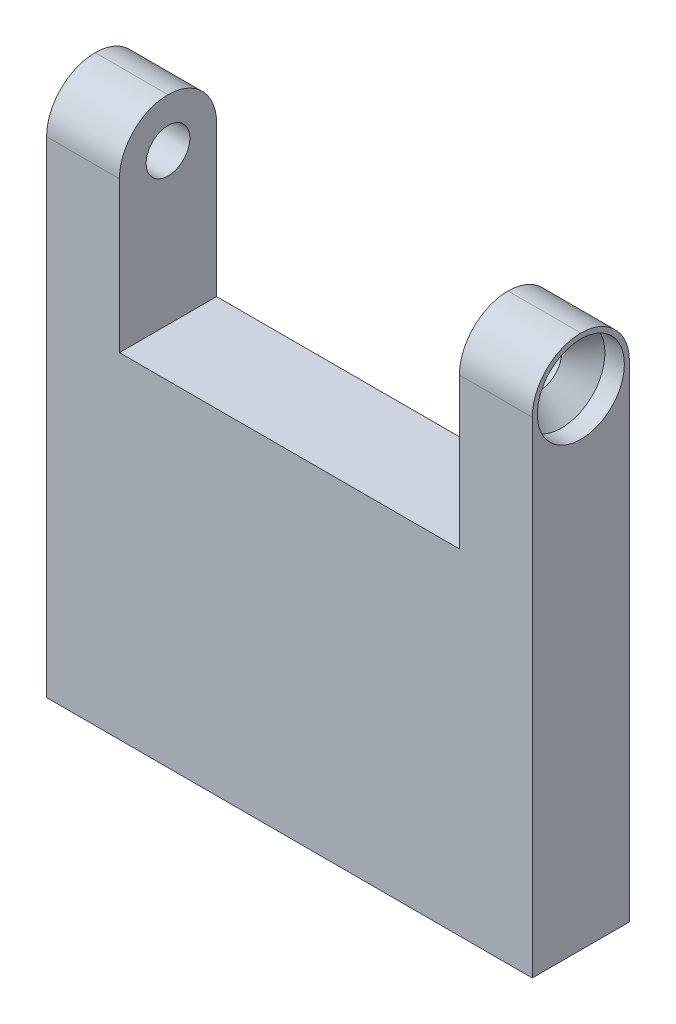
from build123d import *

# Parameters (mm, degrees)
SKETCH1_W                = 50
SKETCH1_H                = 10
BOSS_EXTRUDE1_DEPTH      = 55
FILLET1_R                = 5
SKETCH2_W                = 35
SKETCH2_H                = 20.5
CUT_EXTRUDE1_DEPTH       = 62.23724357
M4_CLEARANCE_HOLE1_D     = 4.5
M4_CLEARANCE_HOLE1_DEPTH = 9
M4_CLEARANCE_HOLE1_TIP   = 1.351936393
SKETCH9_W                = 7.4
SKETCH9_H                = 4
CUT_EXTRUDE2_DEPTH       = 9


with BuildPart() as part:
    # Sketch1 → Boss-Extrude1 (new body)
    with BuildSketch(Plane(origin=(0, 0, 0), x_dir=(1, 0, 0), z_dir=(0, 1, 0))):
        Rectangle(SKETCH1_W, SKETCH1_H)
    extrude(amount=BOSS_EXTRUDE1_DEPTH)

    # Fillet1
    fillet1_edges = [part.edges().sort_by_distance(p)[0] for p in [
        (0, 55, -5),
        (0, 55, 5),
    ]]
    fillet(fillet1_edges, radius=FILLET1_R - 0.0001)  # a hair under: the kernel refuses the full size

    # Sketch2 → Cut-Extrude1 (cut, through all)
    with BuildSketch(Plane.XY.offset(5)):
        with Locations((0, 44.75)):
            Rectangle(SKETCH2_W, SKETCH2_H)
    extrude(amount=-CUT_EXTRUDE1_DEPTH, mode=Mode.SUBTRACT)

    # Sketch5 → CSK for M4 SFHCS1 (revolve, cut)
    with BuildSketch(Plane(origin=(-25, 50, 0), x_dir=(0, 0, 1), z_dir=(0, 1, 0))):
        Polygon((0, 0), (0, 50), (2.25, 50), (2.25, 4.23), (4.48, 2), (4.48, 0), align=None)
    csk_for_m4_sfhcs1 = revolve(axis=Axis((-31.35, 50, 0), (1, 0, 0)), mode=Mode.SUBTRACT)

    # Mirror1: CSK for M4 SFHCS1 across plane
    add(csk_for_m4_sfhcs1.mirror(Plane(origin=(0, 0, 0), x_dir=(0, 0, 1), z_dir=(1, 0, 0))), mode=Mode.SUBTRACT)

    # M4 Clearance Hole1
    with Locations(Plane(origin=(0, 0, 0), x_dir=(-1, 0, 0), z_dir=(0, -1, 0))):
        with Locations((-20, 0), (20, 0)):
            Hole(M4_CLEARANCE_HOLE1_D / 2, depth=M4_CLEARANCE_HOLE1_DEPTH)
            with Locations((0, 0, -(M4_CLEARANCE_HOLE1_DEPTH + M4_CLEARANCE_HOLE1_TIP / 2))):  # 118° drill point
                Cone(0, M4_CLEARANCE_HOLE1_D / 2, M4_CLEARANCE_HOLE1_TIP, mode=Mode.SUBTRACT)

    # Sketch9 → Cut-Extrude2 (cut)
    with BuildSketch(Plane(origin=(0, 0, -5), x_dir=(-1, 0, 0), z_dir=(0, 0, -1))):
        with Locations((20, 7)):
            Rectangle(SKETCH9_W, SKETCH9_H)
    cut_extrude2 = extrude(amount=-CUT_EXTRUDE2_DEPTH, mode=Mode.SUBTRACT)

    # Mirror2: Cut-Extrude2 across plane
    add(cut_extrude2.mirror(Plane(origin=(0, 0, 0), x_dir=(0, 0, 1), z_dir=(1, 0, 0))), mode=Mode.SUBTRACT)


solid = part.part
